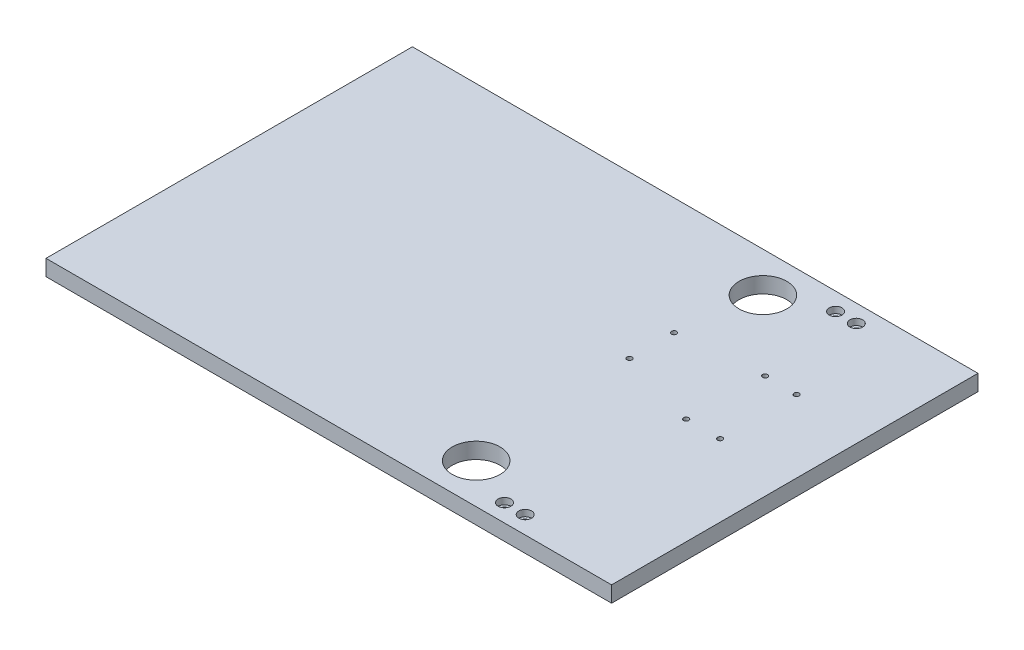
from build123d import *

# Parameters (mm, degrees)
SKETCH11_W                     = 355
SKETCH11_H                     = 230
SKETCH11_R                     = 15
BOSS_EXTRUDE2_DEPTH            = 10
CBORE_FOR_M4_SHCS2_D           = 4.5
CBORE_FOR_M4_SHCS2_CBORE_D     = 8
CBORE_FOR_M4_SHCS2_CBORE_DEPTH = 4
F_3_2_3_2_DIAMETER_HOLE2_D     = 3.2


with BuildPart() as part:
    # Sketch11 → Boss-Extrude2 (new body)
    with BuildSketch(Plane(origin=(0, 0, 0), x_dir=(1, 0, 0), z_dir=(0, 1, 0))):
        Rectangle(SKETCH11_W, SKETCH11_H)
        with Locations((67.5, -90)):
            Circle(SKETCH11_R, mode=Mode.SUBTRACT)
        with Locations((67.5, 90)):
            Circle(SKETCH11_R, mode=Mode.SUBTRACT)
    extrude(amount=BOSS_EXTRUDE2_DEPTH)

    # CBORE for M4 SHCS2 (through all)
    with Locations(Plane(origin=(0, 10, 0), x_dir=(1, 0, 0), z_dir=(0, 1, 0))):
        with Locations((99.2, 103.9), (112.2, 103.9), (112.2, -103.9), (99.2, -103.9)):
            CounterBoreHole(CBORE_FOR_M4_SHCS2_D / 2, CBORE_FOR_M4_SHCS2_CBORE_D / 2, CBORE_FOR_M4_SHCS2_CBORE_DEPTH)

    # Ø3.2 (3.2) Diameter Hole2 (through all)
    with Locations(Plane(origin=(0, 10, 0), x_dir=(1, 0, 0), z_dir=(0, 1, 0))):
        with Locations((132.110460528, 46.535002739), (112.111563058, 46.745002739), (110.841563058, -1.514997261), (132.110460528, -1.514997261), (60.041563058, 13.725002739), (60.041563058, 41.665002739)):
            Hole(F_3_2_3_2_DIAMETER_HOLE2_D / 2)


solid = part.part
